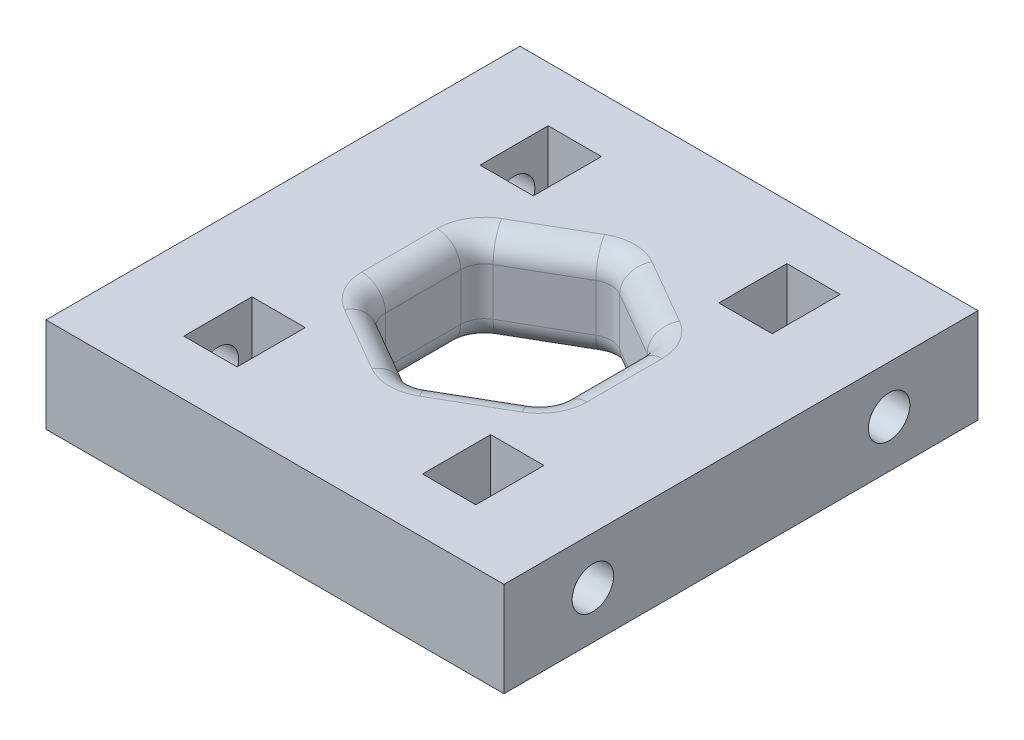
from build123d import *

# Parameters (mm, degrees)
SKETCH1_W           = 40
SKETCH1_H           = 8
BOSS_EXTRUDE1_DEPTH = 19.325
SKETCH2_R           = 1.75
CUT_EXTRUDE1_DEPTH  = 7
CUT_EXTRUDE2_DEPTH  = 4.5
CUT_EXTRUDE3_REACH  = 30.939
FILLET1_R           = 2


with BuildPart() as part:
    # Sketch1 → Boss-Extrude1 (new, symmetric)
    with BuildSketch(Plane(origin=(0, 0, 0), x_dir=(0, 0, -1), z_dir=(1, 0, 0))):
        Rectangle(SKETCH1_W, SKETCH1_H)
    extrude(amount=BOSS_EXTRUDE1_DEPTH, both=True)

    # Sketch2 → Cut-Extrude1 (cut)
    with BuildSketch(Plane(origin=(19.325, 0, 0), x_dir=(0, 0, -1), z_dir=(1, 0, 0))):
        with Locations((-12.5, 0)):
            Circle(SKETCH2_R)
        with Locations((12.5, 0)):
            Circle(SKETCH2_R)
    cut_extrude1 = extrude(amount=-CUT_EXTRUDE1_DEPTH, mode=Mode.SUBTRACT)

    # Sketch3 → Cut-Extrude2 (cut)
    with BuildSketch(Plane(origin=(12.325, 0, 0), x_dir=(0, 0, -1), z_dir=(1, 0, 0))):
        Polygon((-15.375, 4), (-15.375, -1.659882024), (-12.5, -3.319764048), (-9.625, -1.659882024), (-9.625, 4), align=None)
        Polygon((15.375, 4), (9.625, 4), (9.625, -1.659882024), (12.5, -3.319764048), (15.375, -1.659882024), align=None)
    cut_extrude2 = extrude(amount=-CUT_EXTRUDE2_DEPTH, mode=Mode.SUBTRACT)

    # Mirror1: Cut-Extrude1, Cut-Extrude2 across plane
    add(cut_extrude1.mirror(Plane(origin=(0, 0, 0), x_dir=(0, 0, 1), z_dir=(1, 0, 0))), mode=Mode.SUBTRACT)
    add(cut_extrude2.mirror(Plane(origin=(0, 0, 0), x_dir=(0, 0, 1), z_dir=(1, 0, 0))), mode=Mode.SUBTRACT)

    # Sketch4 → Cut-Extrude3 (cut, up to next)
    with BuildSketch(Plane(origin=(0, 4, 0), x_dir=(1, 0, 0), z_dir=(0, 1, 0)), mode=Mode.PRIVATE) as cut_extrude3_sk1:
        Polygon((0, -8.660254038), (7.5, -4.330127019), (7.5, 4.330127019), (0, 8.660254038), (-7.5, 4.330127019), (-7.5, -4.330127019), align=None)
    cut_extrude3_tool1 = extrude(cut_extrude3_sk1.sketch, amount=-CUT_EXTRUDE3_REACH, mode=Mode.PRIVATE) & part.part
    add(cut_extrude3_tool1.solids().sort_by_distance((0, 4, 0))[0], mode=Mode.SUBTRACT)

    # Fillet1
    fillet1_edges = [part.edges().sort_by_distance(p)[0] for p in [
        (7.5, 4, 0),
        (7.5, -4, 0),
        (7.5, 0, 4.330127019),
        (3.75, 4, 6.495190528),
        (3.75, -4, 6.495190528),
        (0, 0, 8.660254038),
        (-3.75, 4, 6.495190528),
        (-3.75, -4, 6.495190528),
        (-7.5, 0, 4.330127019),
        (-7.5, 4, 0),
        (-7.5, -4, 0),
        (-7.5, 0, -4.330127019),
        (-3.75, 4, -6.495190528),
        (-3.75, -4, -6.495190528),
        (0, 0, -8.660254038),
        (3.75, 4, -6.495190528),
        (7.5, 0, -4.330127019),
        (3.75, -4, -6.495190528),
    ]]
    fillet(fillet1_edges, radius=FILLET1_R)


solid = part.part
